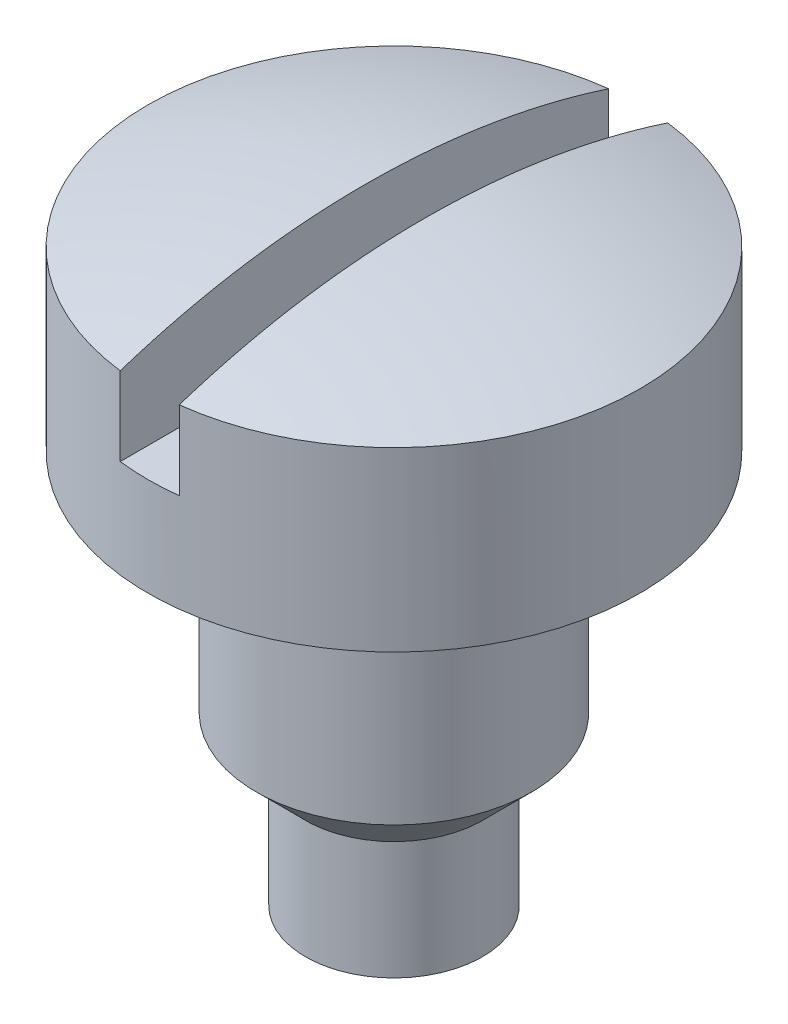
from build123d import *

# Parameters (mm, degrees)
SKETCH1_R               = 1.25
BOSS_EXTRUDE1_DEPTH     = 3.1
SKETCH3_OUTSIDE_W       = 5.44
SKETCH3_OUTSIDE_H       = 5.44
SKETCH3_OUTSIDE_R       = 0.7
CUT_EXTRUDE1_DEPTH      = 2
SKETCH4_OUTSIDE_W       = 5.44
SKETCH4_OUTSIDE_H       = 5.44
SKETCH4_OUTSIDE_R       = 0.45
CUT_EXTRUDE2_DEPTH      = 0.6
CHAMFER1_SIZE           = 0.25
CUT_EXTRUDE3_DEPTH      = 4.568613176
CUT_EXTRUDE3_DEPTH_BACK = 4.568613176


with BuildPart() as part:
    # Sketch1 → Boss-Extrude1 (new body)
    with BuildSketch(Plane(origin=(0, 0, 0), x_dir=(1, 0, 0), z_dir=(0, 1, 0))):
        with Locations(Location((0, 0, 0), (0, 0, 90))):
            Circle(SKETCH1_R)
    extrude(amount=BOSS_EXTRUDE1_DEPTH)

    # Sketch2 → Cut-Revolve1 (revolve, cut)
    with BuildSketch(Plane.XY, mode=Mode.PRIVATE) as cut_revolve1_sk:
        with BuildLine():
            Line((1.25, 2.899671038), (1.25, 3.3))
            Line((1.25, 3.3), (0, 3.3))
            Line((0, 3.3), (0, 3.1))
            ThreePointArc((0, 3.1), (0.632975452, 3.049600243), (1.25, 2.899671038))
        make_face()
    revolve(cut_revolve1_sk.sketch.rotate(Axis((0, 0, 0), (0, 1, 0)), 90), axis=Axis((0, 0, 0), (0, 1, 0)), mode=Mode.SUBTRACT)

    # Sketch3 outside → Cut-Extrude1 (cut)
    with BuildSketch(Plane.XZ):
        Rectangle(SKETCH3_OUTSIDE_W, SKETCH3_OUTSIDE_H)
        with Locations(Location((0, 0, 0), (0, 0, 270))):
            Circle(SKETCH3_OUTSIDE_R, mode=Mode.SUBTRACT)
    extrude(amount=-CUT_EXTRUDE1_DEPTH, mode=Mode.SUBTRACT)

    # Sketch4 outside → Cut-Extrude2 (cut)
    with BuildSketch(Plane.XZ):
        Rectangle(SKETCH4_OUTSIDE_W, SKETCH4_OUTSIDE_H)
        with Locations(Location((0, 0, 0), (0, 0, 270))):
            Circle(SKETCH4_OUTSIDE_R, mode=Mode.SUBTRACT)
    extrude(amount=-CUT_EXTRUDE2_DEPTH, mode=Mode.SUBTRACT)

    # Chamfer1
    chamfer1_edges = [part.edges().sort_by_distance(p)[0] for p in [
        (0, 0.6, 0.7),
    ]]
    chamfer(chamfer1_edges, length=CHAMFER1_SIZE - 0.0001)  # a hair under: the kernel refuses the full size

    # Sketch5 → Cut-Extrude3 (cut, two sides: drawn at the far end of the back side and taken through both)
    with BuildSketch(Plane.XY.offset(-CUT_EXTRUDE3_DEPTH_BACK)):
        with BuildLine():
            Line((-0.15, 3.097186511), (-0.15, 2.5))
            Line((-0.15, 2.5), (0.15, 2.5))
            Line((0.15, 2.5), (0.15, 3.097186511))
            ThreePointArc((0.15, 3.097186511), (0, 3.1), (-0.15, 3.097186511))
        make_face()
    extrude(amount=CUT_EXTRUDE3_DEPTH + CUT_EXTRUDE3_DEPTH_BACK, mode=Mode.SUBTRACT)


solid = part.part
